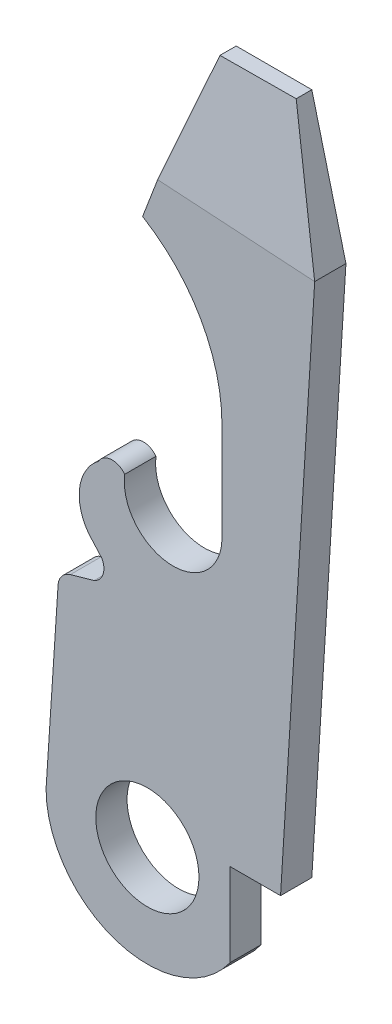
from build123d import *

# Parameters (mm, degrees)
BOSS_EXTRUDE1_DEPTH = 1.27
SKETCH2_R           = 2.0955
CUT_EXTRUDE1_DEPTH  = 67.477075704
CUT_EXTRUDE2_DEPTH  = 49.938083613


with BuildPart() as part:
    # Sketch1 → Boss-Extrude1 (new body)
    with BuildSketch(Plane.XY):
        with BuildLine():
            Line((48.574105004, 39.943813954), (47.188235087, 17.649384858))
            Line((47.188235087, 17.649384858), (45.133527692, 17.649384858))
            Line((45.133527692, 17.649384858), (45.133527692, 14.264259294))
            ThreePointArc((45.133527692, 14.264259294), (40.527605408, 12.727361747), (37.663235087, 16.648070461))
            Line((37.663235087, 16.648070461), (38.148142155, 24.009741916))
            ThreePointArc((38.148142155, 24.009741916), (38.286844948, 24.424515985), (38.647150637, 24.672418797))
            Line((38.647150637, 24.672418797), (39.618122846, 24.951557727))
            ThreePointArc((39.618122846, 24.951557727), (39.978159716, 25.350396748), (39.931693215, 25.885691038))
            Line((39.931693215, 25.885691038), (39.3816335, 26.507566612))
            ThreePointArc((39.3816335, 26.507566612), (39.032246007, 27.949335103), (39.786993153, 29.226490044))
            ThreePointArc((39.786993153, 29.226490044), (40.30097178, 29.556244853), (40.858513771, 29.307128031))
            ThreePointArc((40.858513771, 29.307128031), (42.659979899, 27.067762531), (44.80787568, 28.977365048))
            Line((44.80787568, 28.977365048), (44.80787568, 33.041334939))
            ThreePointArc((44.80787568, 33.041334939), (43.946175814, 36.31433923), (41.584500206, 38.738709679))
            Line((41.584500206, 38.738709679), (44.115219185, 45.366783193))
            Line((44.115219185, 45.366783193), (47.188235087, 45.366783193))
            Line((47.188235087, 45.366783193), (48.574105004, 39.943813954))
        make_face()
    extrude(amount=BOSS_EXTRUDE1_DEPTH)

    # Sketch2 → Cut-Extrude1 (cut, through all)
    with BuildSketch(Plane.XY.offset(1.27)):
        with Locations((41.77872497, 16.648070461)):
            Circle(SKETCH2_R)
    extrude(amount=-CUT_EXTRUDE1_DEPTH, mode=Mode.SUBTRACT)

    # Sketch3 → Cut-Extrude2 (cut, through all)
    with BuildSketch(Plane(origin=(45.913694477, -2.854094522, 0), x_dir=(0, 0, -1), z_dir=(0.9980735141534706, -0.06204240763656757, 0))):
        Polygon((-0.635, 48.207056445), (-1.27, 42.880517185), (-1.27, 48.207056445), align=None)
    extrude(amount=-CUT_EXTRUDE2_DEPTH, mode=Mode.SUBTRACT)


solid = part.part
